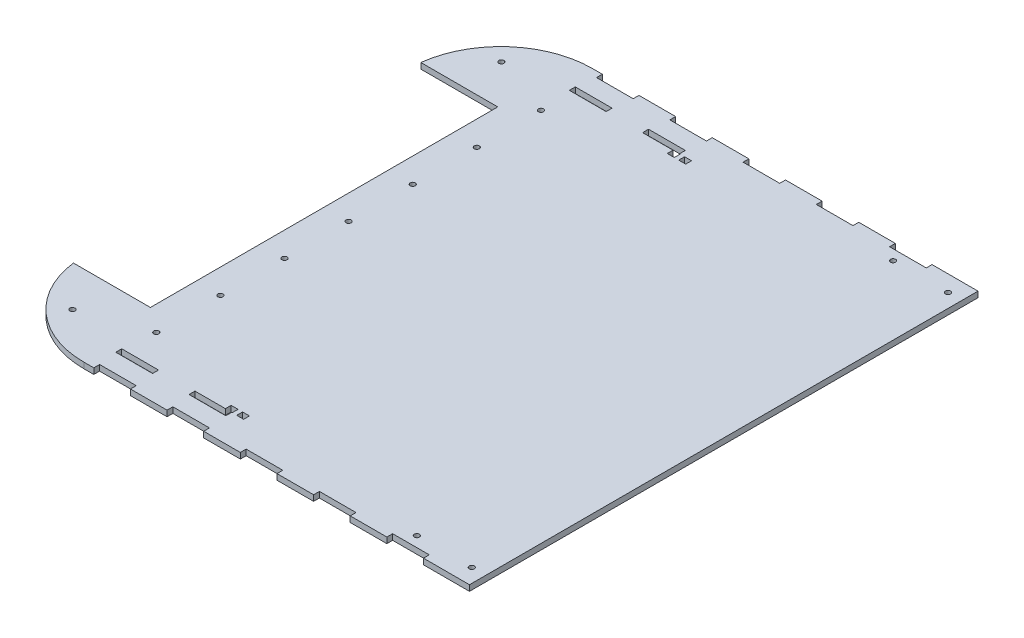
from build123d import *

# Parameters (mm, degrees)
SKETCH2_W           = 20.1
SKETCH2_H           = 3.25
BOSS_EXTRUDE1_DEPTH = 3.15
FILLET1_R           = 50
SKETCH5_W           = 20
SKETCH5_H           = 3.16
CUT_EXTRUDE2_DEPTH  = 255.013877696
SKETCH7_R           = 1.4
CUT_EXTRUDE3_DEPTH  = 255.013877696
SKETCH8_R           = 1.4
CUT_EXTRUDE4_DEPTH  = 10
SKETCH10_R          = 1.4
CUT_EXTRUDE5_DEPTH  = 10
SKETCH11_W          = 3.79
SKETCH11_H          = 3.19
CUT_EXTRUDE6_DEPTH  = 10


with BuildPart() as part:
    # Sketch2 → Boss-Extrude1 (new body)
    with BuildSketch(Plane(origin=(0, 0, 0), x_dir=(1, 0, 0), z_dir=(0, 1, 0))):
        Polygon((-199.52829939, 76.482620099), (-157.52829939, 76.482620099), (-157.52829939, -113.167379901), (-199.52829939, -113.167379901), (-199.52829939, -157.167379901), (60.67170061, -157.167379901), (60.67170061, 120.482620099), (-199.52829939, 120.482620099), align=None)
        with Locations((-95.774503115, 105.482620099)):
            Rectangle(SKETCH2_W, SKETCH2_H, mode=Mode.SUBTRACT)
        with Locations((-135.774503115, -142.167379901)):
            Rectangle(SKETCH2_W, SKETCH2_H, mode=Mode.SUBTRACT)
        with Locations((-95.774503115, -142.167379901)):
            Rectangle(SKETCH2_W, SKETCH2_H, mode=Mode.SUBTRACT)
        with Locations((-135.774503115, 105.482620099)):
            Rectangle(SKETCH2_W, SKETCH2_H, mode=Mode.SUBTRACT)
    extrude(amount=BOSS_EXTRUDE1_DEPTH)

    # Fillet1
    # the kernel refuses this fillet: 50 mm, written as the material it takes off along each edge
    with BuildSketch(Plane(origin=(-199.52829939, -124.09673646, -120.482620099), x_dir=(1, 0, 0), z_dir=(0, 1, 0))) as fillet1_piece_1:
        with BuildLine():
            CenterArc((49.638694584, -50), FILLET1_R, 90, 83.107897421)
            Line((0, -44), (-0.992773892, -43.88))
            ThreePointArc((-0.992773892, -43.88), (-1, -22), (-1, 0))
            Line((-1, 0), (0, 1))
            Line((0, 1), (49.638694584, 1))
            Line((49.638694584, 1), (49.638694584, 0))
        make_face()
    extrude(amount=251.34347292, mode=Mode.SUBTRACT)
    with BuildSketch(Plane(origin=(-199.52829939, -124.09673646, 157.167379901), x_dir=(0, 0, -1), z_dir=(0, 1, 0))) as fillet1_piece_2:
        with BuildLine():
            CenterArc((50, -49.638694584), FILLET1_R, 96.892102579, 83.107897421)
            Line((0, -49.638694584), (-1, -49.638694584))
            Line((-1, -49.638694584), (-1, 0))
            Line((-1, 0), (0, 1))
            ThreePointArc((0, 1), (22, 1), (43.88, 0.992773892))
            Line((43.88, 0.992773892), (44, 0))
        make_face()
    extrude(amount=251.34347292, mode=Mode.SUBTRACT)

    # Sketch5 → Cut-Extrude2 (cut, through all)
    with BuildSketch(Plane(origin=(0, 0, 0), x_dir=(1, 0, 0), z_dir=(0, 1, 0))):
        with Locations((-94.42829939, 118.902620099)):
            Rectangle(SKETCH5_W, SKETCH5_H)
        with Locations((-134.42829939, 118.902620099)):
            Rectangle(SKETCH5_W, SKETCH5_H)
        with Locations((-54.42829939, 118.902620099)):
            Rectangle(SKETCH5_W, SKETCH5_H)
        with Locations((-14.42829939, 118.902620099)):
            Rectangle(SKETCH5_W, SKETCH5_H)
        with Locations((25.57170061, 118.902620099)):
            Rectangle(SKETCH5_W, SKETCH5_H)
        with Locations((25.57170061, -155.587379901)):
            Rectangle(SKETCH5_W, SKETCH5_H)
        with Locations((-14.42829939, -155.587379901)):
            Rectangle(SKETCH5_W, SKETCH5_H)
        with Locations((-54.42829939, -155.587379901)):
            Rectangle(SKETCH5_W, SKETCH5_H)
        with Locations((-94.42829939, -155.587379901)):
            Rectangle(SKETCH5_W, SKETCH5_H)
        with Locations((-134.42829939, -155.587379901)):
            Rectangle(SKETCH5_W, SKETCH5_H)
    extrude(amount=CUT_EXTRUDE2_DEPTH, mode=Mode.SUBTRACT)

    # Sketch7 → Cut-Extrude3 (cut, through all)
    with BuildSketch(Plane.XZ):
        with Locations(Location((23.12170061, 148.342379901, 0), (0, 0, 270))):
            Circle(SKETCH7_R)
        with Locations(Location((53.12170061, 148.342379901, 0), (0, 0, 270))):
            Circle(SKETCH7_R)
        with Locations(Location((53.12170061, -111.657620099, 0), (0, 0, 90))):
            Circle(SKETCH7_R)
        with Locations(Location((23.12170061, -111.657620099, 0), (0, 0, 90))):
            Circle(SKETCH7_R)
    extrude(amount=-CUT_EXTRUDE3_DEPTH, mode=Mode.SUBTRACT)

    # Sketch8 → Cut-Extrude4 (cut)
    with BuildSketch(Plane.XZ):
        with Locations(Location((-177.812570637, 135.451651148, 0), (0, 0, 270))):
            Circle(SKETCH8_R)
        with Locations(Location((-177.812570637, -98.766891346, 0), (0, 0, 270))):
            Circle(SKETCH8_R)
    extrude(amount=-CUT_EXTRUDE4_DEPTH, mode=Mode.SUBTRACT)

    # Sketch10 → Cut-Extrude5 (cut)
    with BuildSketch(Plane(origin=(0, 3.15, 0), x_dir=(1, 0, 0), z_dir=(0, 1, 0))):
        with Locations(Location((-144.129756514, -123.342379901, 0), (0, 0, 270))):
            Circle(SKETCH10_R)
        with Locations(Location((-144.129756514, 86.657620099, 0), (0, 0, 270))):
            Circle(SKETCH10_R)
        with Locations(Location((-144.129756514, 51.657620099, 0), (0, 0, 270))):
            Circle(SKETCH10_R)
        with Locations(Location((-144.129756514, 16.657620099, 0), (0, 0, 270))):
            Circle(SKETCH10_R)
        with Locations(Location((-144.129756514, -18.342379901, 0), (0, 0, 270))):
            Circle(SKETCH10_R)
        with Locations(Location((-144.129756514, -53.342379901, 0), (0, 0, 270))):
            Circle(SKETCH10_R)
        with Locations(Location((-144.129756514, -88.342379901, 0), (0, 0, 270))):
            Circle(SKETCH10_R)
    extrude(amount=-CUT_EXTRUDE5_DEPTH, mode=Mode.SUBTRACT)

    # Sketch11 → Cut-Extrude6 (cut)
    with BuildSketch(Plane.XZ):
        with Locations((-87.319899774, -102.332620099)):
            Rectangle(SKETCH11_W, SKETCH11_H)
        with Locations((-81.069899774, -102.332620099)):
            Rectangle(SKETCH11_W, SKETCH11_H)
        with Locations((-87.319899774, 139.017379901)):
            Rectangle(SKETCH11_W, SKETCH11_H)
        with Locations((-81.069899774, 139.017379901)):
            Rectangle(SKETCH11_W, SKETCH11_H)
    extrude(amount=-CUT_EXTRUDE6_DEPTH, mode=Mode.SUBTRACT)


solid = part.part
